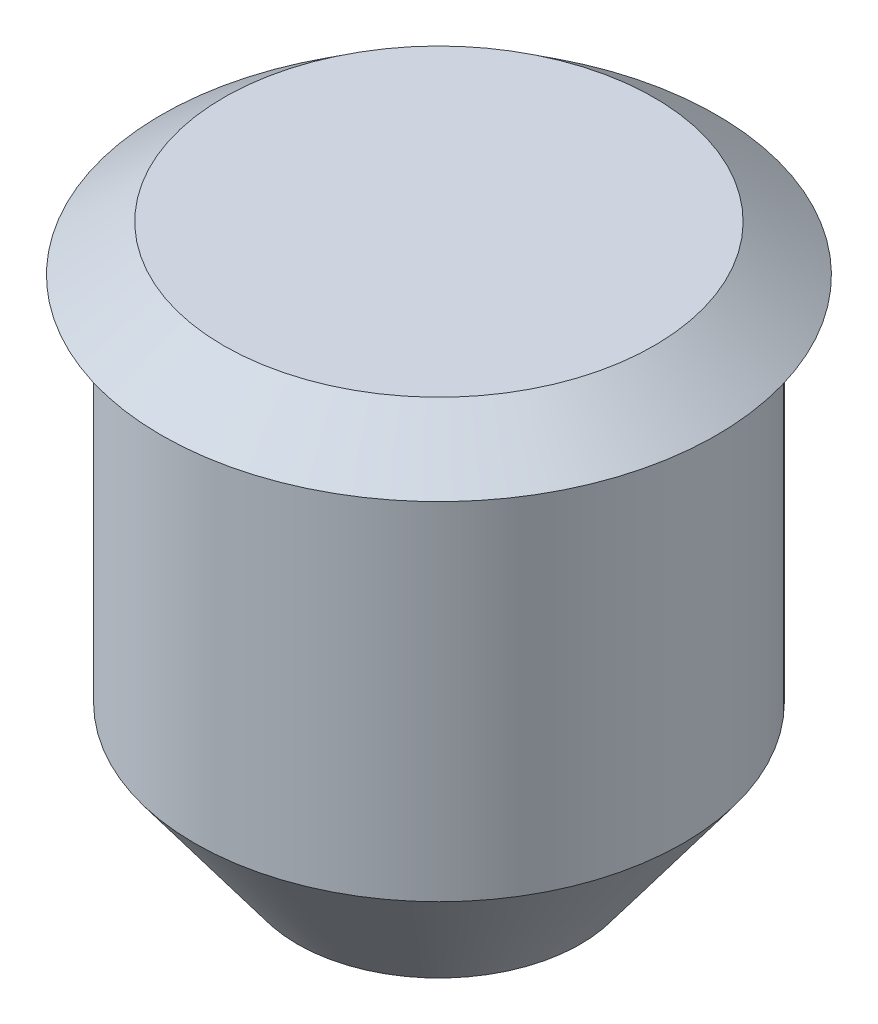
from build123d import *


with BuildPart() as part:
    # Sketch1 → Revolve1 (revolve)
    with BuildSketch(Plane(origin=(0, 0, 0), x_dir=(0, 0, -1), z_dir=(1, 0, 0))):
        Polygon((0, 21.11588159), (-6.975, 21.11588159), (-9, 19.61588159), (-7.92, 19.61588159), (-7.92, 7.61588159), (-4.586666667, 3.11588159), (0, 3.11588159), align=None)
    revolve(axis=Axis((0, 34.131853618, 0), (0, -1, 0)))


solid = part.part
